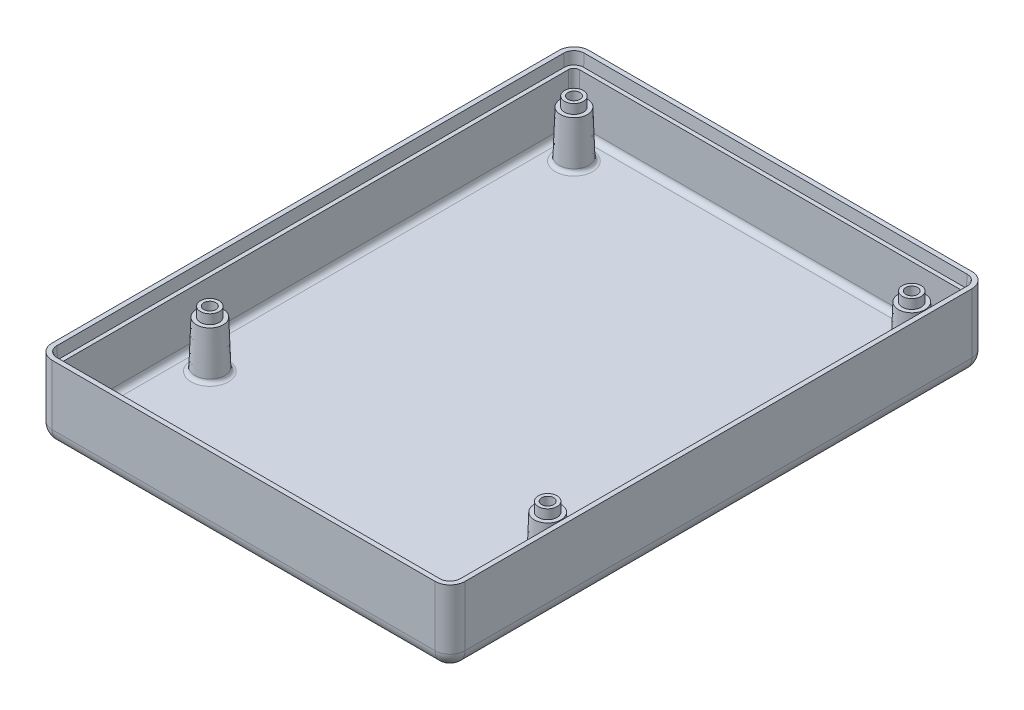
from build123d import *

# Parameters (mm, degrees)
SKETCH2_W               = 69.85
SKETCH2_H               = 90.805
BOSS_EXTRUDE1_DEPTH     = 12.7
FILLET1_R               = 2.54
SHELL1_T                = -1.5875
SKETCH3_R               = 2.8575
SKETCH3_R_2             = 1.5875
CUT_EXTRUDE_THIN1_DEPTH = 1.6
LPATTERN1_COUNT         = 2
LPATTERN1_PITCH         = 57.15
LPATTERN1_COUNT_DIR2    = 2
LPATTERN1_PITCH_DIR2    = 61.595
FILLET3_R               = 0.635


with BuildPart() as part:
    # Sketch2 → Boss-Extrude1 (new body)
    with BuildSketch(Plane(origin=(0, 0, 0), x_dir=(1, 0, 0), z_dir=(0, 1, 0))):
        Rectangle(SKETCH2_W, SKETCH2_H)
    extrude(amount=BOSS_EXTRUDE1_DEPTH)

    # Fillet1
    fillet1_edges = [part.edges().sort_by_distance(p)[0] for p in [
        (34.925, 0, 0),
        (0, 0, 45.4025),
        (-34.925, 0, 0),
        (0, 0, -45.4025),
        (34.925, 6.35, -45.4025),
        (34.925, 6.35, 45.4025),
        (-34.925, 6.35, 45.4025),
        (-34.925, 6.35, -45.4025),
    ]]
    fillet(fillet1_edges, radius=FILLET1_R)

    # Shell1
    shell1_openings = [part.faces().sort_by_distance(p)[0] for p in [
        (0, 12.7, 0),
    ]]
    offset(amount=SHELL1_T, openings=shell1_openings, kind=Kind.INTERSECTION)

    # Groove1: read off the stored shape, not the designer's step
    # Groove1: loft between two sections, ruled curve by curve
    groove1_from = [
        Edge.make_three_point_arc((32.385, 10.668, 44.502257392), (33.544483572, 10.668, 44.021983572), (34.024757392, 10.668, 42.8625)),
        Edge.make_three_point_arc((34.024757392, 10.668, -42.8625), (33.544483572, 10.668, -44.021983572), (32.385, 10.668, -44.502257392)),
        Edge.make_three_point_arc((-32.385, 10.668, -44.502257392), (-33.544483572, 10.668, -44.021983572), (-34.024757392, 10.668, -42.8625)),
        Edge.make_three_point_arc((-34.024757392, 10.668, 42.8625), (-33.544483572, 10.668, 44.021983572), (-32.385, 10.668, 44.502257392)),
        Edge.make_line((32.385, 10.668, 44.502257392), (-32.385, 10.668, 44.502257392)),
        Edge.make_line((34.024757392, 10.668, -42.8625), (34.024757392, 10.668, 42.8625)),
        Edge.make_line((-32.385, 10.668, -44.502257392), (32.385, 10.668, -44.502257392)),
        Edge.make_line((-34.024757392, 10.668, 42.8625), (-34.024757392, 10.668, -42.8625)),
    ]
    groove1_to = [
        Edge.make_three_point_arc((32.385, 12.7, 44.60875), (33.619785217, 12.7, 44.097285217), (34.13125, 12.7, 42.8625)),
        Edge.make_three_point_arc((34.13125, 12.7, -42.8625), (33.619785217, 12.7, -44.097285217), (32.385, 12.7, -44.60875)),
        Edge.make_three_point_arc((-32.385, 12.7, -44.60875), (-33.619785217, 12.7, -44.097285217), (-34.13125, 12.7, -42.8625)),
        Edge.make_three_point_arc((-34.13125, 12.7, 42.8625), (-33.619785217, 12.7, 44.097285217), (-32.385, 12.7, 44.60875)),
        Edge.make_line((32.385, 12.7, 44.60875), (-32.385, 12.7, 44.60875)),
        Edge.make_line((34.13125, 12.7, -42.8625), (34.13125, 12.7, 42.8625)),
        Edge.make_line((-32.385, 12.7, -44.60875), (32.385, 12.7, -44.60875)),
        Edge.make_line((-34.13125, 12.7, 42.8625), (-34.13125, 12.7, -42.8625)),
    ]
    groove1 = Solid(Shell([*[Face.make_surface_from_curves(groove1_from[k], groove1_to[k]) for k in range(8)], Face(Wire(groove1_from)), Face(Wire(groove1_to))]))
    add(groove1, mode=Mode.SUBTRACT)

    # Mounting Boss1: read off the stored shape, not the designer's step
    # Mounting Boss1 outline → Mounting Boss1 (revolve, cut)
    with BuildSketch(Plane(origin=(-28.575, 0, -39.0525), x_dir=(1, 0, 0), z_dir=(0, 0, 1))):
        Polygon((0.83865654, 0.9525), (0.849740506, 1.5875), (0, 1.5875), (0, 0.9525), align=None)
    mounting_boss1 = revolve(axis=Axis((-28.575, 0, -39.0525), (0, 1, 0)), mode=Mode.SUBTRACT)

    # Mounting Boss1 2 outline → Mounting Boss1 2 (revolve)
    with BuildSketch(Plane(origin=(-28.575, 0, -39.0525), x_dir=(1, 0, 0), z_dir=(0, 0, 1))):
        Polygon((2.207379671, 11.1125), (1.016, 11.1125), (0.849740506, 1.5875), (2.54, 1.5875), align=None)
    mounting_boss1_2 = revolve(axis=Axis((-28.575, 0, -39.0525), (0, 1, 0)))

    # Sketch3 → Cut-Extrude-Thin1 (cut)
    with BuildSketch(Plane(origin=(0, 11.1125, 0), x_dir=(1, 0, 0), z_dir=(0, 1, 0))):
        with Locations((-28.575, 39.0525)):
            Circle(SKETCH3_R)
        with Locations((-28.575, 39.0525)):
            Circle(SKETCH3_R_2, mode=Mode.SUBTRACT)
    cut_extrude_thin1 = extrude(amount=-CUT_EXTRUDE_THIN1_DEPTH, mode=Mode.SUBTRACT)

    # LPattern1: Mounting Boss1, Mounting Boss1 2, Cut-Extrude-Thin1 2 × 2
    with Locations(*[(i * LPATTERN1_PITCH, 0, j * LPATTERN1_PITCH_DIR2) for i in range(LPATTERN1_COUNT) for j in range(LPATTERN1_COUNT_DIR2) if (i, j) != (0, 0)]):
        add(mounting_boss1, mode=Mode.SUBTRACT)
        add(mounting_boss1_2)
        add(cut_extrude_thin1, mode=Mode.SUBTRACT)

    # Fillet3
    fillet3_edges = [part.edges().sort_by_distance(p)[0] for p in [
        (-31.115, 1.5875, -39.0525),
        (-31.115, 1.5875, 22.5425),
        (26.035, 1.5875, -39.0525),
        (26.035, 1.5875, 22.5425),
    ]]
    fillet(fillet3_edges, radius=FILLET3_R)


solid = part.part
